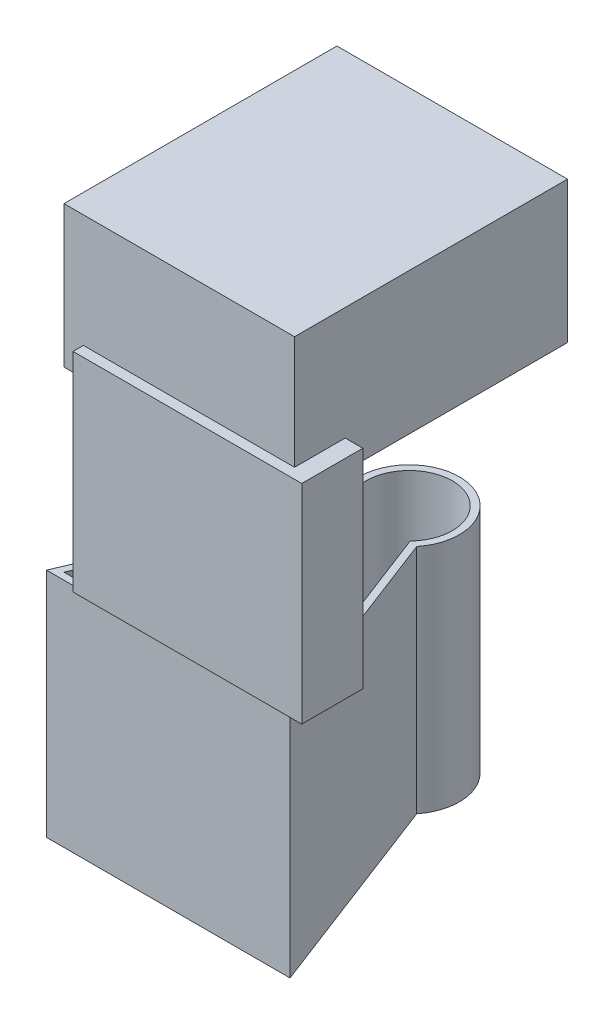
from build123d import *

# Parameters (mm, degrees)
LOFT_THIN1_DEPTH         = 84.63920117
BOSS_EXTRUDE1_DEPTH      = 41.359307983
BOSS_EXTRUDE1_DEPTH_BACK = 10.414
SKETCH8_W                = 84.304447576
SKETCH8_H                = 99.8104289
SKETCH16_W               = 83.624271947
SKETCH16_H               = 22.311451813
BOSS_EXTRUDE2_DEPTH      = 76.2


# Read off the part's stored shape, not the designer's step: Loft-Thin1
with BuildPart() as part:
    # Loft-Thin1 outline → Loft-Thin1 (new body)
    with BuildSketch(Plane(origin=(0, 0, 0), x_dir=(1, 0, 0), z_dir=(0, 1, 0))):
        with BuildLine():
            Line((38.170457439, -37.361978489), (9.323951838, 37.81376338))
            ThreePointArc((9.323951838, 37.81376338), (-5.162903092, 67.673974593), (-18.965674378, 37.491451765))
            Line((-18.965674378, 37.491451765), (-50.875746846, -37.361978489))
            Line((-50.875746846, -37.361978489), (38.170457439, -37.361978489))
        make_face()
        with BuildLine():
            ThreePointArc((-15.982812233, 38.011486845), (-5.185335077, 65.133470666), (6.401715759, 38.339296444))
            Line((6.401715759, 38.339296444), (34.475228233, -34.821978489))
            Line((34.475228233, -34.821978489), (-47.031772168, -34.821978489))
            Line((-47.031772168, -34.821978489), (-15.982812233, 38.011486845))
        make_face(mode=Mode.SUBTRACT)
    extrude(amount=LOFT_THIN1_DEPTH)



with BuildPart() as body_2:
    # Sketch8 → Boss-Extrude1 (new, two sides: drawn at the far end of the back side and taken through both)
    with BuildSketch(Plane(origin=(0, 160, 0), x_dir=(1, 0, 0), z_dir=(0, 1, 0)).offset(-BOSS_EXTRUDE1_DEPTH_BACK)):
        with Locations((-4.87954838, 15.083235961)):
            Rectangle(SKETCH8_W, SKETCH8_H)
    extrude(amount=BOSS_EXTRUDE1_DEPTH + BOSS_EXTRUDE1_DEPTH_BACK)


with BuildPart() as part_1:
    add(part.part)

    add(body_2.part)  # Boss-Extrude2 merges body 2
    # Sketch16 → Boss-Extrude2 (add)
    with BuildSketch(Plane(origin=(0, 160, 0), x_dir=(1, 0, 0), z_dir=(0, 1, 0))):
        with Locations((1.894665963, -27.457802507)):
            Rectangle(SKETCH16_W, SKETCH16_H)
    extrude(amount=-BOSS_EXTRUDE2_DEPTH)


solid = part_1.part
